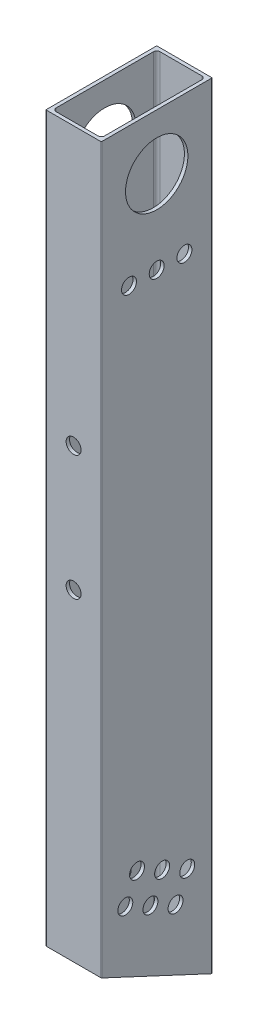
from build123d import *

# Parameters (mm, degrees)
BOSS_EXTRUDE1_DEPTH = 355.6
SKETCH2_R           = 3.429
SKETCH2_R_2         = 14.2875
CUT_EXTRUDE1_DEPTH  = 358.409680899
SKETCH3_R           = 3.429
CUT_EXTRUDE2_DEPTH  = 357.732126392
SKETCH3_3_R         = 9.525
CUT_EXTRUDE3_DEPTH  = 357.732126392


with BuildPart() as part:
    # Sketch1 → Boss-Extrude1 (new body)
    with BuildSketch(Plane(origin=(0, 0, 0), x_dir=(1, 0, 0), z_dir=(0, 1, 0))):
        with BuildLine():
            Line((-12.446, -25.4), (12.446, -25.4))
            ThreePointArc((12.446, -25.4), (12.625605122, -25.325605122), (12.7, -25.146))
            Line((12.7, -25.146), (12.7, 25.146))
            ThreePointArc((12.7, 25.146), (12.625605122, 25.325605122), (12.446, 25.4))
            Line((12.446, 25.4), (-12.446, 25.4))
            ThreePointArc((-12.446, 25.4), (-12.625605122, 25.325605122), (-12.7, 25.146))
            Line((-12.7, 25.146), (-12.7, -25.146))
            ThreePointArc((-12.7, -25.146), (-12.625605122, -25.325605122), (-12.446, -25.4))
        make_face()
        with BuildLine():
            Line((-9.5885, 23.8125), (9.5885, 23.8125))
            ThreePointArc((9.5885, 23.8125), (10.666130735, 23.366130735), (11.1125, 22.2885))
            Line((11.1125, 22.2885), (11.1125, -22.2885))
            ThreePointArc((11.1125, -22.2885), (10.666130735, -23.366130735), (9.5885, -23.8125))
            Line((9.5885, -23.8125), (-9.5885, -23.8125))
            ThreePointArc((-9.5885, -23.8125), (-10.666130735, -23.366130735), (-11.1125, -22.2885))
            Line((-11.1125, -22.2885), (-11.1125, 22.2885))
            ThreePointArc((-11.1125, 22.2885), (-10.666130735, 23.366130735), (-9.5885, 23.8125))
        make_face(mode=Mode.SUBTRACT)
    extrude(amount=BOSS_EXTRUDE1_DEPTH)

    # Sketch2 → Cut-Extrude1 (cut, through all)
    with BuildSketch(Plane.ZY.offset(12.7)):
        with Locations((-8.632581672, 35.844574716)):
            Circle(SKETCH2_R)
        with Locations((0, 330.2)):
            Circle(SKETCH2_R_2)
        with Locations((0, 292.1)):
            Circle(SKETCH2_R)
        with Locations((12.7, 292.1)):
            Circle(SKETCH2_R)
        with Locations((-12.7, 292.1)):
            Circle(SKETCH2_R)
        with Locations((2.877527224, 41.21182664)):
            Circle(SKETCH2_R)
        with Locations((14.387636119, 46.579078564)):
            Circle(SKETCH2_R)
        with Locations((-2.4897247, 52.721935535)):
            Circle(SKETCH2_R)
        with Locations((9.020384195, 58.089187459)):
            Circle(SKETCH2_R)
        with Locations((-13.999833596, 47.354683611)):
            Circle(SKETCH2_R)
        Polygon((-25.4, 0), (25.4, 23.688429034), (25.4, 0), align=None)
    extrude(amount=-CUT_EXTRUDE1_DEPTH, mode=Mode.SUBTRACT)

    # Sketch3 → Cut-Extrude2 (cut, through all)
    with BuildSketch(Plane.XY):
        with Locations((0, 228.6)):
            Circle(SKETCH3_R)
        with Locations((0, 171.45)):
            Circle(SKETCH3_R)
    extrude(amount=CUT_EXTRUDE2_DEPTH, mode=Mode.SUBTRACT)

    # Sketch3<3> → Cut-Extrude3 (cut, through all)
    with BuildSketch(Plane.XY):
        with Locations((0, 228.6)):
            Circle(SKETCH3_3_R)
        with Locations((0, 171.45)):
            Circle(SKETCH3_3_R)
    extrude(amount=-CUT_EXTRUDE3_DEPTH, mode=Mode.SUBTRACT)


solid = part.part
